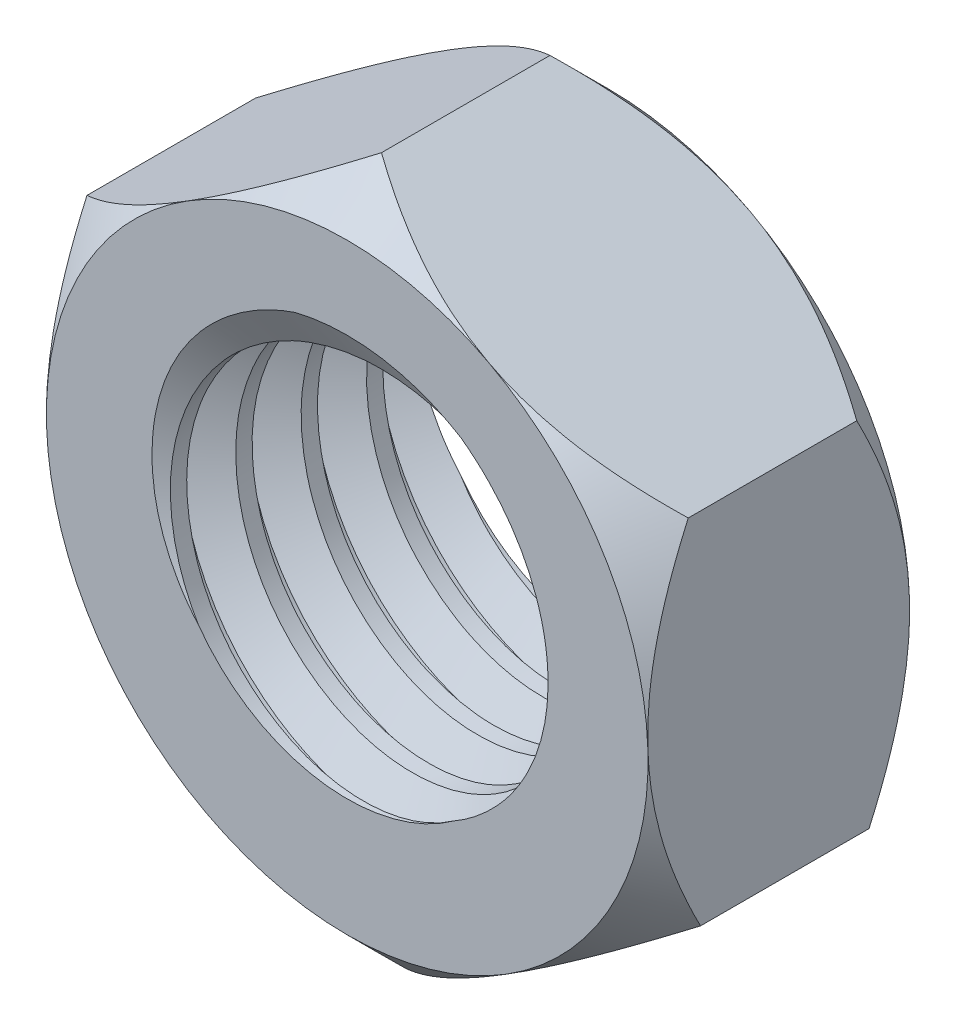
from build123d import *

# Parameters (mm, degrees)
BOSS_EXTRUDE1_DEPTH          = 2.5
SKETCH5_R                    = 3.5
CUT_EXTRUDE2_DEPTH           = 9
THREAD1_PITCH                = 1.25
SKETCH6_OUTSIDE_W            = 37.408
SKETCH6_OUTSIDE_H            = 38.95
SKETCH6_OUTSIDE_R            = 5.75
CUT_EXTRUDE3_DEPTH           = 5
CUT_EXTRUDE3_TAPER           = 45
CUT_EXTRUDE3_OTHER_WAY_DEPTH = 5
CUT_EXTRUDE3_OTHER_WAY_DRAFT = -45
MIRROR1_COPY_1_SKETCH_W      = 37.408
MIRROR1_COPY_1_SKETCH_H      = 38.95
MIRROR1_COPY_1_SKETCH_R      = 5.75
MIRROR1_COPY_1_DEPTH         = 5
MIRROR1_COPY_1_DRAFT         = -45
MIRROR1_COPY_2_SKETCH_W      = 37.408
MIRROR1_COPY_2_SKETCH_H      = 38.95
MIRROR1_COPY_2_SKETCH_R      = 5.75
MIRROR1_COPY_2_DEPTH         = 5
MIRROR1_COPY_2_DRAFT         = -45


with BuildPart() as part:
    # Sketch1 → Boss-Extrude1 (new, symmetric)
    with BuildSketch(Plane.XY):
        Polygon((5.863696897, -3.114545236), (5.629123745, 3.520837855), (-0.234573153, 6.635383091), (-5.863696897, 3.114545236), (-5.629123745, -3.520837855), (0.234573153, -6.635383091), align=None)
    extrude(amount=BOSS_EXTRUDE1_DEPTH, both=True)

    # Sketch5 → Cut-Extrude2 (cut)
    with BuildSketch(Plane.XY.offset(2.5)):
        Circle(SKETCH5_R)
    extrude(amount=-CUT_EXTRUDE2_DEPTH, mode=Mode.SUBTRACT)

    # Thread1: the profile of Thread Profile1 profile screwed along a right-hand helix of 9.6 turns, 8 arcs to a turn; built about Z, then put on its axis
    thread1_z = Axis((0, 0, 0), (0, 0, 1))
    thread1_corners = [(3.4997, 0, -0.000173205), (4.176582344, 0, 0.390624998), (4.176582344, 0, 0.546874998), (3.4997, 0, 0.937673202)]
    with BuildLine(mode=Mode.PRIVATE) as thread1_profile:
        Line(thread1_corners[0], thread1_corners[1])
        Line(thread1_corners[1], thread1_corners[2])
        Line(thread1_corners[2], thread1_corners[3])
        Line(thread1_corners[3], thread1_corners[0])
    thread1_cap = Face(thread1_profile.wire())
    thread1_turn_angles = [0, 22.5, 45, 67.5, 90, 112.5, 135, 157.5, 180, 202.5, 225, 247.5, 270, 292.5, 315, 337.5, 360]
    thread1_turn_weights = [1, 0.9238795325112867, 1, 0.9238795325112867, 1, 0.9238795325112867, 1, 0.9238795325112867, 1, 0.9238795325112867, 1, 0.9238795325112867, 1, 0.9238795325112867, 1, 0.9238795325112867, 1]
    thread1_turn_rails = [Edge.make_bspline([Vector(p[0], p[1], 0).rotate(thread1_z, thread1_turn_angles[k]) / thread1_turn_weights[k] + Vector(0, 0, p[2] + THREAD1_PITCH * thread1_turn_angles[k] / 360) for k in range(17)], [0, 0, 0, 1, 1, 2, 2, 3, 3, 4, 4, 5, 5, 6, 6, 7, 7, 8, 8, 8], 2, thread1_turn_weights) for p in thread1_corners]
    thread1_turn_sides = [Face.make_surface_from_curves(thread1_turn_rails[p[0]], thread1_turn_rails[p[1]]) for p in [(0, 1), (1, 2), (2, 3), (3, 0)]]
    thread1_last_angles = [3240, 3262.5, 3285, 3307.5, 3330, 3352.5, 3375, 3397.5, 3420, 3438, 3456]
    thread1_last_weights = [1, 0.9238795325112867, 1, 0.9238795325112867, 1, 0.9238795325112867, 1, 0.9238795325112867, 1, 0.9510565162951535, 1]
    thread1_last_rails = [Edge.make_bspline([Vector(p[0], p[1], 0).rotate(thread1_z, thread1_last_angles[k]) / thread1_last_weights[k] + Vector(0, 0, p[2] + THREAD1_PITCH * thread1_last_angles[k] / 360) for k in range(11)], [0, 0, 0, 1, 1, 2, 2, 3, 3, 4, 4, 5, 5, 5], 2, thread1_last_weights) for p in thread1_corners]
    thread1_last_sides = [Face.make_surface_from_curves(thread1_last_rails[p[0]], thread1_last_rails[p[1]]) for p in [(0, 1), (1, 2), (2, 3), (3, 0)]]
    thread1 = Plane(origin=(0, 0, -4.5), x_dir=(1, 0, 0), z_dir=(0, 0, 1)) * Solid(Shell([*[p.moved(Location((0, 0, THREAD1_PITCH * i))) for i in range(9) for p in thread1_turn_sides], *thread1_last_sides, thread1_cap, thread1_cap.rotate(thread1_z, 3456).moved(Location((0, 0, THREAD1_PITCH * 3456 / 360)))]))
    add(thread1, mode=Mode.SUBTRACT)

    # Sketch6 outside → Cut-Extrude3 (cut)
    with BuildSketch(Plane.XY.offset(2.5)):
        Rectangle(SKETCH6_OUTSIDE_W, SKETCH6_OUTSIDE_H)
        Circle(SKETCH6_OUTSIDE_R, mode=Mode.SUBTRACT)
    cut_extrude3 = extrude(amount=CUT_EXTRUDE3_DEPTH, taper=CUT_EXTRUDE3_TAPER, mode=Mode.SUBTRACT)


with BuildPart() as cut_extrude3_other_way_tool:
    # Sketch6 outside → Cut-Extrude3 other way (with draft: the straight prism first)
    with BuildSketch(Plane.XY.offset(2.5)):
        Rectangle(SKETCH6_OUTSIDE_W, SKETCH6_OUTSIDE_H)
        Circle(SKETCH6_OUTSIDE_R, mode=Mode.SUBTRACT)
    extrude(amount=-CUT_EXTRUDE3_OTHER_WAY_DEPTH)
    # Cut-Extrude3 other way: the draft: its side faces are tilted about the plane it starts from
    cut_extrude3_other_way_sides = [cut_extrude3_other_way_tool.faces().sort_by_distance(p)[0] for p in [
        (0, -19.475, 0),
        (18.704, 0, 0),
        (0, 19.475, 0),
        (-18.704, 0, 0),
        (-5.75, 0, 0),
    ]]
    draft(cut_extrude3_other_way_sides, Plane.XY.offset(2.5), CUT_EXTRUDE3_OTHER_WAY_DRAFT)


with BuildPart() as part_1:
    add(part.part)

    # Cut-Extrude3 other way: cut by cut_extrude3_other_way_tool
    add(cut_extrude3_other_way_tool.part, mode=Mode.SUBTRACT)

    # Mirror1: Cut-Extrude3 across plane
    add(cut_extrude3.mirror(Plane.XY), mode=Mode.SUBTRACT)


with BuildPart() as mirror1_copy_1_tool:
    # Mirror1 copy 1 sketch → Mirror1 copy 1 (with draft: the straight prism first)
    with BuildSketch(Plane(origin=(0, 0, -2.5), x_dir=(1, 0, 0), z_dir=(0, 0, -1))):
        Rectangle(MIRROR1_COPY_1_SKETCH_W, MIRROR1_COPY_1_SKETCH_H)
        Circle(MIRROR1_COPY_1_SKETCH_R, mode=Mode.SUBTRACT)
    extrude(amount=-MIRROR1_COPY_1_DEPTH)
    # Mirror1 copy 1: the draft: its side faces are tilted about the plane it starts from
    mirror1_copy_1_sides = [mirror1_copy_1_tool.faces().sort_by_distance(p)[0] for p in [
        (0, -19.475, 0),
        (18.704, 0, 0),
        (0, 19.475, 0),
        (-18.704, 0, 0),
        (-5.75, 0, 0),
    ]]
    draft(mirror1_copy_1_sides, Plane(origin=(0, 0, -2.5), x_dir=(1, 0, 0), z_dir=(0, 0, -1)), MIRROR1_COPY_1_DRAFT)


with BuildPart() as part_2:
    add(part_1.part)

    # Mirror1 copy 1: cut by mirror1_copy_1_tool
    add(mirror1_copy_1_tool.part, mode=Mode.SUBTRACT)


with BuildPart() as mirror1_copy_2_tool:
    # Mirror1 copy 2 sketch → Mirror1 copy 2 (with draft: the straight prism first)
    with BuildSketch(Plane(origin=(0, 0, -2.5), x_dir=(1, 0, 0), z_dir=(0, 0, -1))):
        Rectangle(MIRROR1_COPY_2_SKETCH_W, MIRROR1_COPY_2_SKETCH_H)
        Circle(MIRROR1_COPY_2_SKETCH_R, mode=Mode.SUBTRACT)
    extrude(amount=-MIRROR1_COPY_2_DEPTH)
    # Mirror1 copy 2: the draft: its side faces are tilted about the plane it starts from
    mirror1_copy_2_sides = [mirror1_copy_2_tool.faces().sort_by_distance(p)[0] for p in [
        (0, -19.475, 0),
        (18.704, 0, 0),
        (0, 19.475, 0),
        (-18.704, 0, 0),
        (-5.75, 0, 0),
    ]]
    draft(mirror1_copy_2_sides, Plane(origin=(0, 0, -2.5), x_dir=(1, 0, 0), z_dir=(0, 0, -1)), MIRROR1_COPY_2_DRAFT)


with BuildPart() as part_3:
    add(part_2.part)

    # Mirror1 copy 2: cut by mirror1_copy_2_tool
    add(mirror1_copy_2_tool.part, mode=Mode.SUBTRACT)


solid = part_3.part
